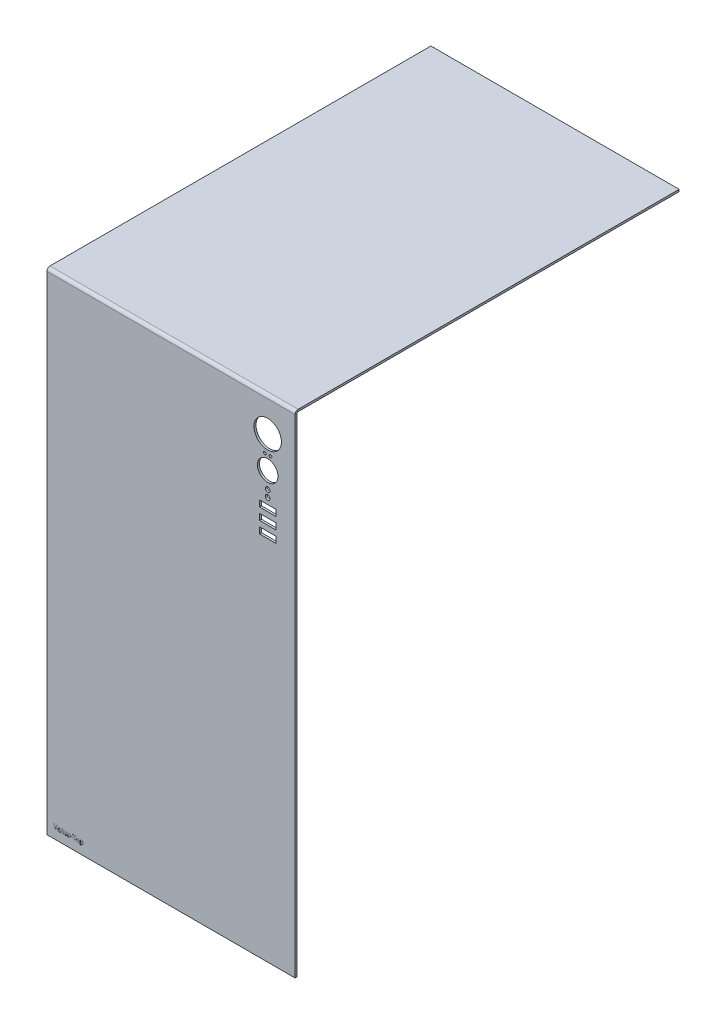
from build123d import *

# Parameters (mm, degrees)
SKETCH1_W                    = 181
SKETCH1_H                    = 358
BASE_FLANGE1_DEPTH           = 1.5
EDGE_FLANGE1_STRIP_W         = 7.4732
EDGE_FLANGE1_STRIP_H         = 1.5
EDGE_FLANGE1_STRIP_CUT_DEPTH = 181
EDGE_FLANGE1_DEPTH           = 181
CUT_EXTRUDE1_REACH           = 491.209
SKETCH9_R                    = 10
SKETCH9_R_2                  = 7.5
SKETCH9_R_3                  = 1
SKETCH9_R_4                  = 1.75
SKETCH9_W                    = 12
SKETCH9_H                    = 4.5
SKETCH10_W                   = 0.527397261
SKETCH10_H                   = 3.5
SKETCH10_W_2                 = 1.246575343
SKETCH10_H_2                 = 0.383561644
CUT_EXTRUDE2_DEPTH           = 0.05


# Sheet-metal steps are written as plain solids
with BuildPart() as part:
    # Sketch1 → Base-Flange1 (new body)
    with BuildSketch(Plane.XY):
        with Locations((90.5, -179)):
            Rectangle(SKETCH1_W, SKETCH1_H)
    extrude(amount=-BASE_FLANGE1_DEPTH)

    # Edge-Flange1 strip (across the edge) → Edge-Flange1 strip cut (cut)
    with BuildSketch(Plane(origin=(0, 0, -1.5), x_dir=(0, -1, 0), z_dir=(1, 0, 0))):
        with Locations((-1.5, -0.75)):
            Rectangle(EDGE_FLANGE1_STRIP_W, EDGE_FLANGE1_STRIP_H)
    extrude(amount=EDGE_FLANGE1_STRIP_CUT_DEPTH, mode=Mode.SUBTRACT)

    # Edge-Flange1 section (across the edge) → Edge-Flange1 (add)
    with BuildSketch(Plane(origin=(0, 0, -1.5), x_dir=(0, -1, 0), z_dir=(1, 0, 0))):
        with BuildLine():
            Line((0, 0.7366), (0, 278.5))
            Line((0, 278.5), (1.5, 278.5))
            Line((1.5, 278.5), (1.5, 0.7366))
            ThreePointArc((1.5, 0.7366), (1.715745145, 0.215745145), (2.2366, 0))
            Line((2.2366, 0), (2.2366, -1.5))
            ThreePointArc((2.2366, -1.5), (0.655084973, -0.844915027), (0, 0.7366))
        make_face()
    extrude(amount=EDGE_FLANGE1_DEPTH)

    # Sketch9 → Cut-Extrude1 (cut, up to next)
    with BuildSketch(Plane.XY, mode=Mode.PRIVATE) as cut_extrude1_sk1:
        with Locations((161, -24.566303236)):
            Circle(SKETCH9_R)
    cut_extrude1_tool1 = extrude(cut_extrude1_sk1.sketch, amount=-CUT_EXTRUDE1_REACH, mode=Mode.PRIVATE) & part.part
    # Sketch9 → Cut-Extrude1 (cut, up to next)
    with BuildSketch(Plane.XY, mode=Mode.PRIVATE) as cut_extrude1_sk2:
        with Locations((161, -47.566303236)):
            Circle(SKETCH9_R_2)
    cut_extrude1_tool2 = extrude(cut_extrude1_sk2.sketch, amount=-CUT_EXTRUDE1_REACH, mode=Mode.PRIVATE) & part.part
    # Sketch9 → Cut-Extrude1 (cut, up to next)
    with BuildSketch(Plane.XY, mode=Mode.PRIVATE) as cut_extrude1_sk3:
        with Locations((159, -37.566303236)):
            Circle(SKETCH9_R_3)
    cut_extrude1_tool3 = extrude(cut_extrude1_sk3.sketch, amount=-CUT_EXTRUDE1_REACH, mode=Mode.PRIVATE) & part.part
    # Sketch9 → Cut-Extrude1 (cut, up to next)
    with BuildSketch(Plane.XY, mode=Mode.PRIVATE) as cut_extrude1_sk4:
        with Locations((163, -37.566303236)):
            Circle(SKETCH9_R_3)
    cut_extrude1_tool4 = extrude(cut_extrude1_sk4.sketch, amount=-CUT_EXTRUDE1_REACH, mode=Mode.PRIVATE) & part.part
    # Sketch9 → Cut-Extrude1 (cut, up to next)
    with BuildSketch(Plane.XY, mode=Mode.PRIVATE) as cut_extrude1_sk5:
        with Locations((161, -59.566303236)):
            Circle(SKETCH9_R_4)
    cut_extrude1_tool5 = extrude(cut_extrude1_sk5.sketch, amount=-CUT_EXTRUDE1_REACH, mode=Mode.PRIVATE) & part.part
    # Sketch9 → Cut-Extrude1 (cut, up to next)
    with BuildSketch(Plane.XY, mode=Mode.PRIVATE) as cut_extrude1_sk6:
        with Locations((161, -64.566303236)):
            Circle(SKETCH9_R_4)
    cut_extrude1_tool6 = extrude(cut_extrude1_sk6.sketch, amount=-CUT_EXTRUDE1_REACH, mode=Mode.PRIVATE) & part.part
    # Sketch9 → Cut-Extrude1 (cut, up to next)
    with BuildSketch(Plane.XY, mode=Mode.PRIVATE) as cut_extrude1_sk7:
        with Locations((161, -71.316303236)):
            Rectangle(SKETCH9_W, SKETCH9_H)
    cut_extrude1_tool7 = extrude(cut_extrude1_sk7.sketch, amount=-CUT_EXTRUDE1_REACH, mode=Mode.PRIVATE) & part.part
    # Sketch9 → Cut-Extrude1 (cut, up to next)
    with BuildSketch(Plane.XY, mode=Mode.PRIVATE) as cut_extrude1_sk8:
        with Locations((161, -79.816303236)):
            Rectangle(SKETCH9_W, SKETCH9_H)
    cut_extrude1_tool8 = extrude(cut_extrude1_sk8.sketch, amount=-CUT_EXTRUDE1_REACH, mode=Mode.PRIVATE) & part.part
    # Sketch9 → Cut-Extrude1 (cut, up to next)
    with BuildSketch(Plane.XY, mode=Mode.PRIVATE) as cut_extrude1_sk9:
        with Locations((161, -88.316303236)):
            Rectangle(SKETCH9_W, SKETCH9_H)
    cut_extrude1_tool9 = extrude(cut_extrude1_sk9.sketch, amount=-CUT_EXTRUDE1_REACH, mode=Mode.PRIVATE) & part.part
    add(cut_extrude1_tool1.solids().sort_by_distance((161, -24.566303, 0))[0], mode=Mode.SUBTRACT)
    add(cut_extrude1_tool2.solids().sort_by_distance((161, -47.566303, 0))[0], mode=Mode.SUBTRACT)
    add(cut_extrude1_tool3.solids().sort_by_distance((159, -37.566303, 0))[0], mode=Mode.SUBTRACT)
    add(cut_extrude1_tool4.solids().sort_by_distance((163, -37.566303, 0))[0], mode=Mode.SUBTRACT)
    add(cut_extrude1_tool5.solids().sort_by_distance((161, -59.566303, 0))[0], mode=Mode.SUBTRACT)
    add(cut_extrude1_tool6.solids().sort_by_distance((161, -64.566303, 0))[0], mode=Mode.SUBTRACT)
    add(cut_extrude1_tool7.solids().sort_by_distance((161, -71.316303, 0))[0], mode=Mode.SUBTRACT)
    add(cut_extrude1_tool8.solids().sort_by_distance((161, -79.816303, 0))[0], mode=Mode.SUBTRACT)
    add(cut_extrude1_tool9.solids().sort_by_distance((161, -88.316303, 0))[0], mode=Mode.SUBTRACT)

    # Sketch10 → Cut-Extrude2 (cut)
    # profile 1 of 9: a face of its own
    with BuildSketch(Plane.XY):
        Polygon((7.759056417, -348.134137559), (6.600130903, -351.634137559), (6.059998198, -351.634137559), (4.882344088, -348.134137559), (5.455439123, -348.134137559), (6.366398027, -350.962904683), (7.259377479, -348.134137559), align=None)
    # profile 2 of 9: a face of its own
    with BuildSketch(Plane.XY):
        with BuildLine():
            Line((10.204261897, -351.634137559), (9.685105218, -351.634137559))
            add(Edge.make_bspline(
                [(9.685105218, -351.634137559), (9.680035856, -351.605217846), (9.668894197, -351.54165687), (9.658416308, -351.43704997), (9.6513483, -351.315325913), (9.648445583, -351.228610032), (9.646898883, -351.182403826)],
                knots=[0, 0, 0, 0, 0.776151292, 1.705858299, 2.777575903, 4, 4, 4, 4], degree=3))
            add(Edge.make_bspline(
                [(9.646898883, -351.182403826), (9.640333765, -351.202796198), (9.627460621, -351.24278237), (9.60108452, -351.299214363), (9.572547503, -351.352693016), (9.538220376, -351.401380383), (9.501053969, -351.446919972), (9.458285163, -351.487160807), (9.412892053, -351.525180687), (9.362089338, -351.558056417), (9.307382254, -351.587211527), (9.248718405, -351.61260362), (9.186279336, -351.634731649), (9.11914033, -351.651349465), (9.048268778, -351.665940682), (8.972899975, -351.67556207), (8.893575706, -351.680448495), (8.839327861, -351.681530028), (8.811603506, -351.682082765)],
                knots=[0, 0, 0, 0, 0.975469499, 1.912739392, 2.834749978, 3.734574456, 4.623535464, 5.508992012, 6.40672647, 7.319061521, 8.261087935, 9.229559954, 10.230268345, 11.276544069, 12.379245833, 13.527021249, 14.736138942, 16, 16, 16, 16], degree=3))
            add(Edge.make_bspline(
                [(8.811603506, -351.682082765), (8.776372094, -351.68131196), (8.7077456, -351.679810527), (8.607647815, -351.669651848), (8.513960419, -351.650825011), (8.426299127, -351.625106915), (8.344469471, -351.593626465), (8.269436001, -351.553007102), (8.200079866, -351.50617028), (8.138478398, -351.451059175), (8.082746487, -351.392117939), (8.035010879, -351.329045011), (7.993912137, -351.263552081), (7.961079133, -351.194780063), (7.934192389, -351.123556784), (7.916820302, -351.048696976), (7.904889202, -350.971277994), (7.903564094, -350.918502411), (7.902892034, -350.891736018)],
                knots=[0, 0, 0, 0, 1.249730742, 2.434323096, 3.563471788, 4.634200097, 5.672110158, 6.666786976, 7.654458243, 8.633552524, 9.592362774, 10.527770243, 11.434773132, 12.330109344, 13.226890318, 14.129209857, 15.05118427, 16, 16, 16, 16], degree=3))
            add(Edge.make_bspline(
                [(7.902892034, -350.891736018), (7.903864329, -350.859458481), (7.905775731, -350.796005221), (7.921924233, -350.703144913), (7.948391161, -350.615022999), (7.984289034, -350.530817623), (8.03203171, -350.452168362), (8.089725679, -350.377640051), (8.158362981, -350.308390763), (8.236734856, -350.242174475), (8.327955967, -350.182658228), (8.433402489, -350.131952877), (8.552312199, -350.08850751), (8.685408867, -350.054069661), (8.831785678, -350.026299332), (8.99200314, -350.007552345), (9.166003664, -349.995214191), (9.286787004, -349.994094052), (9.34948878, -349.993512559)],
                knots=[0, 0, 0, 0, 0.808525439, 1.589451338, 2.353749103, 3.110605451, 3.876950355, 4.653096827, 5.467414761, 6.316003643, 7.220384927, 8.188825422, 9.242177308, 10.388307889, 11.630476528, 12.97341699, 14.428821987, 16, 16, 16, 16], degree=3))
            add(Edge.make_bspline(
                [(9.34948878, -349.993512559), (9.368219552, -349.993670026), (9.408938575, -349.994012346), (9.474350601, -349.996665233), (9.548790887, -349.999363797), (9.601205934, -350.002396884), (9.628919431, -350.004000573)],
                knots=[0, 0, 0, 0, 0.803713308, 1.747200887, 2.808873687, 4, 4, 4, 4], degree=3))
            add(Edge.make_bspline(
                [(9.628919431, -350.004000573), (9.62869943, -349.969767606), (9.628285966, -349.905431058), (9.619894422, -349.81608042), (9.607881578, -349.739905866), (9.589633823, -349.675466887), (9.561181021, -349.62030414), (9.522608996, -349.570833742), (9.468876981, -349.530475287), (9.405925615, -349.492919908), (9.329775334, -349.464439793), (9.24222235, -349.442327208), (9.142241262, -349.431464373), (9.071824489, -349.429624324), (9.034848369, -349.428658107)],
                knots=[0, 0, 0, 0, 1.264261331, 2.376019809, 3.311853705, 4.111591798, 4.837811274, 5.592820636, 6.406904951, 7.304104159, 8.29438249, 9.397532684, 10.633434353, 12, 12, 12, 12], degree=3))
            add(Edge.make_bspline(
                [(9.034848369, -349.428658107), (8.993804545, -349.429824009), (8.915412225, -349.432050844), (8.804302644, -349.452238486), (8.705882179, -349.48576181), (8.620343677, -349.533470452), (8.547605937, -349.595014511), (8.48922629, -349.671107949), (8.443334984, -349.76020775), (8.424878875, -349.826027065), (8.415306417, -349.860164956)],
                knots=[0, 0, 0, 0, 1.192066422, 2.276806714, 3.268390141, 4.201035685, 5.107124908, 6.017390214, 6.971698217, 8, 8, 8, 8], degree=3))
            Line((8.415306417, -349.860164956), (7.950837239, -349.788996292))
            add(Edge.make_bspline(
                [(7.950837239, -349.788996292), (7.957268594, -349.756896216), (7.969863694, -349.694031752), (7.997827899, -349.604038636), (8.032129356, -349.519967691), (8.07457493, -349.442855776), (8.122399396, -349.370697302), (8.178384116, -349.30578475), (8.239857331, -349.245655753), (8.309548789, -349.193430207), (8.385326535, -349.146573309), (8.468770905, -349.107077857), (8.558287824, -349.072521965), (8.655138553, -349.044981145), (8.758247155, -349.023199144), (8.868483822, -349.008875063), (8.985207081, -348.998477316), (9.065538084, -348.997601005), (9.106766177, -348.997151258)],
                knots=[0, 0, 0, 0, 1.015436062, 1.988619719, 2.919794507, 3.828378544, 4.71609894, 5.601244657, 6.48367207, 7.379575014, 8.298020962, 9.244295137, 10.240262638, 11.272854284, 12.36569163, 13.507735132, 14.720900723, 16, 16, 16, 16], degree=3))
            add(Edge.make_bspline(
                [(9.106766177, -348.997151258), (9.152741907, -348.997754624), (9.241615874, -348.998920968), (9.36953505, -349.011053485), (9.487241339, -349.030377568), (9.594608735, -349.056643268), (9.691296299, -349.091965287), (9.777483641, -349.134921339), (9.854198986, -349.18467452), (9.919394385, -349.244709679), (9.976955684, -349.312110492), (10.024277085, -349.390386791), (10.06605905, -349.477221627), (10.099564481, -349.574258364), (10.124411766, -349.681324918), (10.143122904, -349.797693886), (10.154344779, -349.923872559), (10.155644031, -350.011218926), (10.156316691, -350.056440641)],
                knots=[0, 0, 0, 0, 1.271049596, 2.457018525, 3.549108944, 4.567381627, 5.508965739, 6.389090511, 7.226032361, 8.027764574, 8.831457087, 9.66882613, 10.549086337, 11.492517066, 12.500789717, 13.584948391, 14.74965862, 16, 16, 16, 16], degree=3))
            Line((10.156316691, -350.056440641), (10.156316691, -351.106740299))
            add(Edge.make_bspline(
                [(10.156316691, -351.106740299), (10.156882847, -351.150956219), (10.158013123, -351.23922908), (10.16747644, -351.371444742), (10.182004817, -351.503245758), (10.19684157, -351.590499315), (10.204261897, -351.634137559)],
                knots=[0, 0, 0, 0, 1.000520471, 1.997443518, 2.998458622, 4, 4, 4, 4], degree=3))
        make_face()
        with BuildLine():
            add(Edge.make_bspline(
                [(9.628919431, -350.432510847), (9.599457503, -350.430681947), (9.543297882, -350.427195741), (9.46338059, -350.423492775), (9.391706091, -350.421022833), (9.346743638, -350.420684349), (9.325516177, -350.420524546)],
                knots=[0, 0, 0, 0, 1.166393908, 2.223352165, 3.16121744, 4, 4, 4, 4], degree=3))
            add(Edge.make_bspline(
                [(9.325516177, -350.420524546), (9.292290233, -350.420643982), (9.227527261, -350.420876785), (9.133615755, -350.427510993), (9.045456351, -350.43566159), (8.963851749, -350.44973459), (8.887725714, -350.465410803), (8.818164636, -350.486906474), (8.753803581, -350.510254098), (8.696409684, -350.538968857), (8.644522325, -350.570131356), (8.600182866, -350.606447752), (8.562090787, -350.646092906), (8.531954116, -350.690465055), (8.507652147, -350.737900178), (8.490072827, -350.789553231), (8.480674252, -350.845447765), (8.479061771, -350.883962568), (8.478234499, -350.903722319)],
                knots=[0, 0, 0, 0, 1.45711978, 2.840172304, 4.1285782, 5.33879564, 6.471148492, 7.535094115, 8.530030164, 9.470655413, 10.346197382, 11.179391502, 11.977571569, 12.749381569, 13.523442768, 14.309808512, 15.132859021, 16, 16, 16, 16], degree=3))
            add(Edge.make_bspline(
                [(8.478234499, -350.903722319), (8.479445078, -350.928830972), (8.48178857, -350.977437434), (8.502373634, -351.046637177), (8.537856621, -351.106999347), (8.585949724, -351.158875521), (8.647081842, -351.200934045), (8.721275789, -351.229334717), (8.806464583, -351.247769608), (8.867181138, -351.249605922), (8.899253335, -351.250575915)],
                knots=[0, 0, 0, 0, 0.976096897, 1.889572353, 2.778295161, 3.679479282, 4.623283261, 5.639651782, 6.753197474, 8, 8, 8, 8], degree=3))
            add(Edge.make_bspline(
                [(8.899253335, -351.250575915), (8.925269089, -351.250176624), (8.976277759, -351.24939374), (9.050887322, -351.238017728), (9.122089778, -351.222210387), (9.18957268, -351.19853163), (9.253553287, -351.168377768), (9.314392436, -351.131898795), (9.37097154, -351.087636459), (9.423676676, -351.037998194), (9.471169091, -350.983492858), (9.51355873, -350.926300705), (9.549553113, -350.866761621), (9.578335181, -350.804334221), (9.600601599, -350.740025801), (9.617481056, -350.673446907), (9.627381805, -350.604366112), (9.62840296, -350.557399606), (9.628919431, -350.533645265)],
                knots=[0, 0, 0, 0, 1.094244261, 2.145467124, 3.170711452, 4.161578386, 5.149260772, 6.144580063, 7.141397536, 8.167773332, 9.188479246, 10.181018155, 11.16190609, 12.112112195, 13.069734655, 14.023424357, 15.000303466, 16, 16, 16, 16], degree=3))
            add(Edge.make_bspline(
                [(9.628919431, -350.533645265), (9.628919431, -350.514916669), (9.628919431, -350.481205196), (9.628919431, -350.447493724), (9.628919431, -350.432510847)],
                knots=[0, 0, 0, 0, 1.111111111, 2, 2, 2, 2], degree=3))
        make_face(mode=Mode.SUBTRACT)
    # profile 3 of 9: a face of its own
    with BuildSketch(Plane.XY):
        with Locations((11.139193404, -349.884137559)):
            Rectangle(SKETCH10_W, SKETCH10_H)
    # profile 4 of 9: a face of its own
    with BuildSketch(Plane.XY):
        with BuildLine():
            Line((14.231659157, -351.634137559), (13.752207102, -351.634137559))
            Line((13.752207102, -351.634137559), (13.752207102, -351.154685504))
            add(Edge.make_bspline(
                [(13.752207102, -351.154685504), (13.738827363, -351.196438865), (13.713010237, -351.277004849), (13.653376472, -351.385417215), (13.580865067, -351.478423487), (13.492213817, -351.553636353), (13.389237327, -351.612041972), (13.272031803, -351.652980512), (13.14095714, -351.677925197), (13.048878792, -351.680656882), (13.000815835, -351.682082765)],
                knots=[0, 0, 0, 0, 1.052079265, 2.030059363, 2.957411664, 3.873028321, 4.806135154, 5.787941106, 6.845351887, 8, 8, 8, 8], degree=3))
            add(Edge.make_bspline(
                [(13.000815835, -351.682082765), (12.967573937, -351.681122542), (12.902866759, -351.679253416), (12.8083768, -351.667531048), (12.719963143, -351.64622607), (12.636430216, -351.618121911), (12.559202305, -351.580025431), (12.486303924, -351.535113857), (12.419810049, -351.480791132), (12.358543635, -351.41895508), (12.303974017, -351.349335801), (12.256817068, -351.272546091), (12.216581789, -351.189324846), (12.184767627, -351.098962158), (12.159405692, -351.001972914), (12.140503901, -350.898606147), (12.130302916, -350.788311076), (12.128825128, -350.712710435), (12.128063266, -350.673735162)],
                knots=[0, 0, 0, 0, 1.055403191, 2.054400236, 3.01579575, 3.938364529, 4.845997079, 5.743429036, 6.650923101, 7.564628224, 8.501861714, 9.452245446, 10.420187899, 11.43069321, 12.488237783, 13.600011547, 14.7627062, 16, 16, 16, 16], degree=3))
            Line((12.128063266, -350.673735162), (12.128063266, -349.045096463))
            Line((12.128063266, -349.045096463), (12.655460527, -349.045096463))
            Line((12.655460527, -349.045096463), (12.655460527, -350.659501429))
            add(Edge.make_bspline(
                [(12.655460527, -350.659501429), (12.655920634, -350.688228339), (12.656797926, -350.743002253), (12.662591769, -350.821602671), (12.672903123, -350.892454532), (12.687032868, -350.955867614), (12.704644763, -351.011862025), (12.727068951, -351.060371249), (12.754011744, -351.101450195), (12.794802911, -351.14435422), (12.849452132, -351.185951483), (12.91730412, -351.222424898), (12.986063835, -351.245966798), (13.032607685, -351.249056193), (13.055503335, -351.250575915)],
                knots=[0, 0, 0, 0, 1.284959724, 2.450046835, 3.522634902, 4.484597285, 5.353544529, 6.143050038, 6.867966782, 7.539733069, 8.781939257, 9.921255061, 10.977432771, 12, 12, 12, 12], degree=3))
            add(Edge.make_bspline(
                [(13.055503335, -351.250575915), (13.083823089, -351.249469917), (13.139800544, -351.247283777), (13.221298838, -351.228482277), (13.298879858, -351.199080346), (13.372212165, -351.157444182), (13.439972775, -351.103608794), (13.503946114, -351.04061673), (13.559517983, -350.965217559), (13.610462707, -350.882244416), (13.652390992, -350.791413263), (13.682244952, -350.694951183), (13.700934431, -350.594548199), (13.703144432, -350.526235055), (13.704261897, -350.49169321)],
                knots=[0, 0, 0, 0, 0.921127991, 1.820722076, 2.708665052, 3.615360246, 4.553873904, 5.519813939, 6.529723644, 7.595131107, 8.686655073, 9.777088182, 10.876007279, 12, 12, 12, 12], degree=3))
            Line((13.704261897, -350.49169321), (13.704261897, -349.045096463))
            Line((13.704261897, -349.045096463), (14.231659157, -349.045096463))
            Line((14.231659157, -349.045096463), (14.231659157, -351.634137559))
        make_face()
    # profile 5 of 9: a face of its own
    with BuildSketch(Plane.XY):
        with BuildLine():
            Line((16.64839717, -350.771123861), (17.108371486, -350.865515984))
            add(Edge.make_bspline(
                [(17.108371486, -350.865515984), (17.099086831, -350.894894055), (17.080658068, -350.953205485), (17.045120517, -351.037435259), (17.003304404, -351.117798774), (16.95432146, -351.19352526), (16.899298115, -351.265269723), (16.837547587, -351.332818025), (16.769336116, -351.396661003), (16.694761868, -351.455319835), (16.615323311, -351.508774645), (16.531577531, -351.555082717), (16.443849404, -351.594352422), (16.352676131, -351.626548778), (16.257628097, -351.651165654), (16.159037761, -351.669377227), (16.056547144, -351.679760198), (15.986925594, -351.681302353), (15.951693403, -351.682082765)],
                knots=[0, 0, 0, 0, 0.970376838, 1.926064515, 2.876295158, 3.821332085, 4.764007728, 5.721992307, 6.701765842, 7.704491662, 8.708328194, 9.715581711, 10.715803919, 11.733604561, 12.758436724, 13.806327211, 14.889885399, 16, 16, 16, 16], degree=3))
            add(Edge.make_bspline(
                [(15.951693403, -351.682082765), (15.90818032, -351.680943238), (15.823049845, -351.678713829), (15.698628478, -351.660901986), (15.580390307, -351.632981841), (15.468773821, -351.591949811), (15.363377697, -351.540249734), (15.264324152, -351.476699739), (15.172011557, -351.401409908), (15.086730978, -351.31520247), (15.009931416, -351.219786516), (14.94306025, -351.116419704), (14.885557775, -351.006532209), (14.839276385, -350.889182807), (14.803181869, -350.765026246), (14.778139558, -350.633832242), (14.761854782, -350.495847906), (14.760002154, -350.401344201), (14.759056417, -350.3531016)],
                knots=[0, 0, 0, 0, 1.04006308, 2.034814766, 2.999340677, 3.940044222, 4.872008889, 5.801215012, 6.747756153, 7.714644925, 8.69566404, 9.67116158, 10.653978049, 11.656334954, 12.682403234, 13.741017884, 14.846826472, 16, 16, 16, 16], degree=3))
            add(Edge.make_bspline(
                [(14.759056417, -350.3531016), (14.759918335, -350.303852797), (14.761603541, -350.207562408), (14.779026759, -350.066877683), (14.804594074, -349.932859765), (14.841782757, -349.805946002), (14.891263854, -349.686968215), (14.949580541, -349.5743538), (15.019571798, -349.469249876), (15.099729932, -349.372200854), (15.187450433, -349.283999328), (15.282178477, -349.207175266), (15.382569308, -349.142523174), (15.487808405, -349.088304391), (15.599729525, -349.048578805), (15.716076201, -349.017839326), (15.838563697, -349.000697114), (15.921927421, -348.998348602), (15.964428849, -348.997151258)],
                knots=[0, 0, 0, 0, 1.161981899, 2.271886461, 3.341228114, 4.380111636, 5.387202716, 6.378576049, 7.369318291, 8.361812572, 9.345497792, 10.301088288, 11.23469979, 12.160012026, 13.088679061, 14.032285896, 14.996797951, 16, 16, 16, 16], degree=3))
            add(Edge.make_bspline(
                [(15.964428849, -348.997151258), (16.008941514, -348.99796407), (16.095825268, -348.999550588), (16.22219393, -349.017554901), (16.341674673, -349.045141542), (16.454448591, -349.083521795), (16.559195501, -349.13546904), (16.657406307, -349.196794212), (16.747801336, -349.270387561), (16.831307231, -349.354454194), (16.906558389, -349.449991301), (16.972122559, -349.557370786), (17.027169948, -349.676200248), (17.073099395, -349.806104822), (17.108664554, -349.947351677), (17.134599092, -350.100138786), (17.151148129, -350.264101297), (17.154066356, -350.377284064), (17.155567547, -350.435507422)],
                knots=[0, 0, 0, 0, 1.007988209, 1.967480452, 2.885707445, 3.784034793, 4.659637926, 5.52935221, 6.402465227, 7.294730762, 8.209394118, 9.151713907, 10.138952695, 11.171606156, 12.269526521, 13.435146202, 14.680590665, 16, 16, 16, 16], degree=3))
            Line((17.155567547, -350.435507422), (15.334398883, -350.435507422))
            add(Edge.make_bspline(
                [(15.334398883, -350.435507422), (15.335206347, -350.473978131), (15.33675064, -350.547554168), (15.345953, -350.653369017), (15.363478713, -350.749177655), (15.385613936, -350.83604779), (15.417119253, -350.912305984), (15.453006829, -350.980060363), (15.498091924, -351.036916819), (15.564536453, -351.098697847), (15.654662587, -351.158015629), (15.765709757, -351.210586026), (15.878070944, -351.244371834), (15.953971433, -351.248527), (15.991398027, -351.250575915)],
                knots=[0, 0, 0, 0, 1.168215704, 2.234237016, 3.220252785, 4.123285562, 4.949738847, 5.720030982, 6.443529022, 7.140809292, 8.467714642, 9.698914626, 10.865332904, 12, 12, 12, 12], degree=3))
            add(Edge.make_bspline(
                [(15.991398027, -351.250575915), (16.027977547, -351.249215819), (16.099368743, -351.246561358), (16.202374126, -351.223537933), (16.29757636, -351.185732607), (16.384820815, -351.132399399), (16.464250386, -351.064128756), (16.534975181, -350.980457866), (16.597675252, -350.882016524), (16.631053788, -350.80904147), (16.64839717, -350.771123861)],
                knots=[0, 0, 0, 0, 1.010202366, 1.971582825, 2.900930486, 3.830278146, 4.784918799, 5.783736102, 6.848436203, 8, 8, 8, 8], degree=3))
        make_face()
        with BuildLine():
            add(Edge.make_bspline(
                [(16.580974225, -350.051945778), (16.579414395, -350.028924581), (16.576257679, -349.982335288), (16.563253271, -349.912253423), (16.542510997, -349.841782376), (16.516315719, -349.770636222), (16.48056142, -349.701706588), (16.434327522, -349.63697386), (16.376781903, -349.578727293), (16.310433946, -349.526341016), (16.235445976, -349.482388781), (16.151973465, -349.450820463), (16.060939702, -349.431641317), (15.997737644, -349.429672419), (15.965177992, -349.428658107)],
                knots=[0, 0, 0, 0, 0.850487428, 1.721179275, 2.621893019, 3.557525288, 4.51320381, 5.47674886, 6.479715867, 7.522526024, 8.587189943, 9.671587617, 10.800477401, 12, 12, 12, 12], degree=3))
            add(Edge.make_bspline(
                [(15.965177992, -349.428658107), (15.945422612, -349.429281513), (15.906241381, -349.430517927), (15.848529427, -349.438935934), (15.792611152, -349.452524254), (15.738293868, -349.471274998), (15.685655891, -349.495924369), (15.635662395, -349.527325427), (15.586306019, -349.562197242), (15.540689931, -349.603666624), (15.496840613, -349.647875131), (15.45923799, -349.697064084), (15.424433491, -349.747841147), (15.397515789, -349.803404434), (15.372691899, -349.860695798), (15.355378372, -349.92203375), (15.341286877, -349.98576355), (15.33671896, -350.029653671), (15.334398883, -350.051945778)],
                knots=[0, 0, 0, 0, 0.971932655, 1.927652895, 2.863418533, 3.799909913, 4.750799854, 5.715951772, 6.701535727, 7.719892262, 8.745266678, 9.760430749, 10.762346635, 11.767947569, 12.792511849, 13.830544334, 14.898117893, 16, 16, 16, 16], degree=3))
            Line((15.334398883, -350.051945778), (16.580974225, -350.051945778))
        make_face(mode=Mode.SUBTRACT)
    # profile 6 of 9: a face of its own
    with BuildSketch(Plane.XY):
        with Locations((18.019330389, -350.339617011)):
            Rectangle(SKETCH10_W_2, SKETCH10_H_2)
    # profile 7 of 9: a face of its own
    with BuildSketch(Plane.XY):
        Polygon((20.224809842, -351.634137559), (19.649467376, -351.634137559), (19.649467376, -348.613589614), (18.690563266, -348.613589614), (18.690563266, -348.134137559), (21.183713951, -348.134137559), (21.183713951, -348.613589614), (20.224809842, -348.613589614), align=None)
    # profile 8 of 9: a face of its own
    with BuildSketch(Plane.XY):
        with BuildLine():
            add(Edge.make_bspline(
                [(22.51943741, -351.682082765), (22.475404256, -351.681108291), (22.389661933, -351.679210775), (22.265062912, -351.659319139), (22.147546429, -351.6303903), (22.03791393, -351.586775808), (21.935131467, -351.532163349), (21.840596437, -351.464200665), (21.75336473, -351.384497104), (21.674612229, -351.293429352), (21.604991964, -351.1931015), (21.542912681, -351.087204621), (21.491093211, -350.975028994), (21.449363552, -350.857015851), (21.416247913, -350.73353396), (21.392400387, -350.604565754), (21.377782489, -350.469807679), (21.376267102, -350.378110564), (21.375494773, -350.331376429)],
                knots=[0, 0, 0, 0, 1.061341894, 2.066668209, 3.036833985, 3.975400648, 4.905246388, 5.8380341, 6.776136663, 7.749737721, 8.735783364, 9.718381832, 10.707550845, 11.711703294, 12.734600131, 13.78853052, 14.872907676, 16, 16, 16, 16], degree=3))
            add(Edge.make_bspline(
                [(21.375494773, -350.331376429), (21.37648362, -350.282145342), (21.378416422, -350.185918118), (21.394008184, -350.045452407), (21.421498523, -349.912831302), (21.457546222, -349.787041957), (21.505941447, -349.668992029), (21.564243689, -349.558283616), (21.634053183, -349.45568965), (21.712879668, -349.360850809), (21.80032599, -349.276178753), (21.89289446, -349.200983561), (21.991159433, -349.137939797), (22.095058438, -349.086596918), (22.203627787, -349.045925007), (22.317696016, -349.017363778), (22.436795576, -349.000846082), (22.517887927, -348.998397119), (22.559142034, -348.997151258)],
                knots=[0, 0, 0, 0, 1.181478652, 2.309321578, 3.386031207, 4.42915366, 5.445324698, 6.442727674, 7.426842105, 8.418320792, 9.397403229, 10.343742355, 11.276450625, 12.19315355, 13.120531573, 14.053778892, 15.009899073, 16, 16, 16, 16], degree=3))
            add(Edge.make_bspline(
                [(22.559142034, -348.997151258), (22.605910825, -348.998159973), (22.69734593, -349.000132057), (22.829992786, -349.019621261), (22.955027583, -349.049095779), (23.071828297, -349.091903978), (23.180414897, -349.147697963), (23.280784518, -349.215872036), (23.373558425, -349.295338783), (23.456192051, -349.387473123), (23.530388495, -349.486952556), (23.595542035, -349.592671144), (23.649956703, -349.703723), (23.695468677, -349.819563154), (23.729732249, -349.940847239), (23.754352522, -350.067127145), (23.769707999, -350.198651144), (23.771728096, -350.288133815), (23.772755047, -350.333623861)],
                knots=[0, 0, 0, 0, 1.105317622, 2.160945972, 3.163558409, 4.138823878, 5.094913291, 6.043256811, 7.002132521, 7.976163556, 8.963547238, 9.933829605, 10.908361759, 11.884377858, 12.873190933, 13.884254739, 14.924424741, 16, 16, 16, 16], degree=3))
            add(Edge.make_bspline(
                [(23.772755047, -350.333623861), (23.771894206, -350.38087843), (23.770207981, -350.473441182), (23.752641083, -350.609109874), (23.727210069, -350.739182675), (23.689520681, -350.863389858), (23.640790671, -350.981296007), (23.580983206, -351.092996221), (23.511116923, -351.198879084), (23.431648751, -351.298246515), (23.342477436, -351.387796419), (23.24654712, -351.467424612), (23.14231321, -351.533498365), (23.031185299, -351.587737812), (22.913305373, -351.630820217), (22.788059533, -351.660342406), (22.656088456, -351.678885235), (22.565698502, -351.681000291), (22.51943741, -351.682082765)],
                knots=[0, 0, 0, 0, 1.097126729, 2.149063523, 3.172955721, 4.173089872, 5.158803593, 6.131994298, 7.111818611, 8.102028355, 9.08238485, 10.04276665, 10.992206533, 11.941735018, 12.910645961, 13.901161508, 14.925825754, 16, 16, 16, 16], degree=3))
        make_face()
        with BuildLine():
            add(Edge.make_bspline(
                [(22.54865402, -351.250575915), (22.571160602, -351.249753455), (22.615384309, -351.248137383), (22.680557623, -351.238399822), (22.743045, -351.221269097), (22.80227255, -351.196054498), (22.859013592, -351.165342975), (22.912756659, -351.127322379), (22.963591098, -351.082225212), (23.011731675, -351.03023799), (23.056536051, -350.971279535), (23.093710236, -350.902724937), (23.12568622, -350.826857603), (23.153149505, -350.74310094), (23.172695066, -350.65086649), (23.186566958, -350.550959302), (23.195933303, -350.443174195), (23.196906934, -350.368605014), (23.197412581, -350.329878141)],
                knots=[0, 0, 0, 0, 0.851960802, 1.674037608, 2.488088101, 3.297295633, 4.105177318, 4.925949067, 5.783084561, 6.672595414, 7.604530661, 8.577638254, 9.61517014, 10.718101912, 11.90833532, 13.178168094, 14.534505499, 16, 16, 16, 16], degree=3))
            add(Edge.make_bspline(
                [(23.197412581, -350.329878141), (23.196856949, -350.291158199), (23.195787069, -350.216602363), (23.187101212, -350.108896842), (23.171056031, -350.009901848), (23.15080027, -349.918639239), (23.123046307, -349.836106761), (23.089485166, -349.761649653), (23.048731558, -349.696277324), (23.00284656, -349.638739238), (22.952299931, -349.589929778), (22.900546647, -349.546157906), (22.845583693, -349.510959244), (22.78995638, -349.479670182), (22.731085192, -349.457802908), (22.670717621, -349.441152191), (22.608250303, -349.429933003), (22.56568292, -349.429086256), (22.544159157, -349.428658107)],
                knots=[0, 0, 0, 0, 1.483754111, 2.856991061, 4.136040058, 5.324537516, 6.435126464, 7.467072189, 8.446945409, 9.379509932, 10.27949352, 11.135943353, 11.971995376, 12.776965168, 13.576684854, 14.370658526, 15.176140078, 16, 16, 16, 16], degree=3))
            add(Edge.make_bspline(
                [(22.544159157, -349.428658107), (22.525138406, -349.429170748), (22.487339828, -349.430189482), (22.431478296, -349.440343155), (22.377463222, -349.456815296), (22.325195624, -349.479895337), (22.273732605, -349.508200543), (22.224580618, -349.544412519), (22.177307951, -349.587125367), (22.13015848, -349.634616481), (22.08741915, -349.690973666), (22.050471387, -349.75621601), (22.020030083, -349.830373305), (21.994866437, -349.91295058), (21.974554397, -350.004072044), (21.960666885, -350.104023284), (21.952594044, -350.212877579), (21.951437667, -350.288411209), (21.950837239, -350.32763071)],
                knots=[0, 0, 0, 0, 0.756320576, 1.502981824, 2.251162625, 2.998881281, 3.77301222, 4.584026971, 5.421698356, 6.307225525, 7.243388263, 8.22703282, 9.282737436, 10.426926748, 11.658977428, 12.994127987, 14.439254114, 16, 16, 16, 16], degree=3))
            add(Edge.make_bspline(
                [(21.950837239, -350.32763071), (21.951452064, -350.369094761), (21.952638557, -350.449112275), (21.960530499, -350.564225869), (21.974730146, -350.669293785), (21.993820528, -350.76462161), (22.019273246, -350.850071625), (22.049391405, -350.926369319), (22.086327579, -350.992309165), (22.128720301, -351.048283787), (22.175097763, -351.095638049), (22.223110691, -351.136774863), (22.272320774, -351.172901986), (22.324704594, -351.19986084), (22.377512272, -351.223602361), (22.433155092, -351.238622298), (22.490323786, -351.249116576), (22.529127382, -351.250087387), (22.54865402, -351.250575915)],
                knots=[0, 0, 0, 0, 1.609501114, 3.10602256, 4.475479225, 5.722524972, 6.875622541, 7.93220141, 8.900043992, 9.79956054, 10.649563263, 11.467514925, 12.252885294, 13.011790242, 13.749985317, 14.495588805, 15.242954357, 16, 16, 16, 16], degree=3))
        make_face(mode=Mode.SUBTRACT)
    # profile 9 of 9: a face of its own
    with BuildSketch(Plane.XY):
        with BuildLine():
            Line((24.827549568, -352.497151258), (24.300152307, -352.497151258))
            Line((24.300152307, -352.497151258), (24.300152307, -349.045096463))
            Line((24.300152307, -349.045096463), (24.779604362, -349.045096463))
            Line((24.779604362, -349.045096463), (24.779604362, -349.572493724))
            add(Edge.make_bspline(
                [(24.779604362, -349.572493724), (24.78573933, -349.549160876), (24.797741922, -349.503511952), (24.821374709, -349.438385125), (24.84728037, -349.377273548), (24.877434173, -349.321073225), (24.910400385, -349.269167425), (24.946430006, -349.2215221), (24.986316833, -349.178579613), (25.029903018, -349.140403107), (25.076521442, -349.106501407), (25.126204697, -349.077192993), (25.179067651, -349.052229456), (25.235536525, -349.032026613), (25.295479373, -349.016417335), (25.35860632, -349.005271115), (25.424962065, -348.998349512), (25.47029755, -348.997557352), (25.493538438, -348.997151258)],
                knots=[0, 0, 0, 0, 1.154591624, 2.258869823, 3.313891012, 4.330193312, 5.308655691, 6.255637477, 7.18624941, 8.109690524, 9.025670621, 9.94227479, 10.867571758, 11.820647877, 12.809573837, 13.829807145, 14.88746733, 16, 16, 16, 16], degree=3))
            add(Edge.make_bspline(
                [(25.493538438, -348.997151258), (25.535301221, -348.998270032), (25.616983559, -349.000458201), (25.736246482, -349.018534378), (25.848339598, -349.049685861), (25.954297025, -349.091166469), (26.05242398, -349.14701468), (26.144380336, -349.213621619), (26.22869726, -349.293532122), (26.306219566, -349.383709752), (26.374804254, -349.483022334), (26.436456031, -349.587487135), (26.487047589, -349.698196758), (26.529397975, -349.813797549), (26.561390132, -349.93501309), (26.584514993, -350.061478382), (26.599217349, -350.193186698), (26.600746691, -350.282892795), (26.60152217, -350.328379854)],
                knots=[0, 0, 0, 0, 1.032400941, 2.019236126, 2.973502293, 3.904591322, 4.825240442, 5.757741251, 6.705733437, 7.690963807, 8.693097297, 9.686517747, 10.686651672, 11.698516496, 12.727532476, 13.782439121, 14.875546656, 16, 16, 16, 16], degree=3))
            add(Edge.make_bspline(
                [(26.60152217, -350.328379854), (26.600753762, -350.377607951), (26.599252536, -350.473784072), (26.584763203, -350.614554972), (26.560750292, -350.747956657), (26.528476927, -350.874681537), (26.484102064, -350.993208203), (26.432931036, -351.105978958), (26.37029938, -351.210778252), (26.299527663, -351.308018932), (26.220953656, -351.395893096), (26.135320321, -351.472934408), (26.042669943, -351.537736615), (25.943673984, -351.590396267), (25.838778667, -351.632168135), (25.727303152, -351.661110217), (25.609464852, -351.678669174), (25.528810254, -351.680927399), (25.487545287, -351.682082765)],
                knots=[0, 0, 0, 0, 1.19900762, 2.342481368, 3.442706028, 4.499207359, 5.523118662, 6.522038026, 7.512156496, 8.491677521, 9.448047426, 10.378645842, 11.291679483, 12.195260249, 13.10465884, 14.035754238, 14.995041354, 16, 16, 16, 16], degree=3))
            add(Edge.make_bspline(
                [(25.487545287, -351.682082765), (25.446998329, -351.680908048), (25.369100888, -351.678651222), (25.257845372, -351.658192737), (25.1575426, -351.624741065), (25.068365768, -351.57683654), (24.990014557, -351.51548082), (24.92339277, -351.439945536), (24.867837451, -351.350976982), (24.841271431, -351.284772045), (24.827549568, -351.250575915)],
                knots=[0, 0, 0, 0, 1.145853088, 2.201374124, 3.18627696, 4.124736396, 5.050137253, 5.985589098, 6.959517814, 8, 8, 8, 8], degree=3))
            Line((24.827549568, -351.250575915), (24.827549568, -352.497151258))
        make_face()
        with BuildLine():
            Line((24.827549568, -350.021980025), (24.827549568, -350.678230025))
            add(Edge.make_bspline(
                [(24.827549568, -350.678230025), (24.830955212, -350.699273312), (24.837661994, -350.740714143), (24.853465105, -350.80096948), (24.874329381, -350.857913577), (24.900443754, -350.911391292), (24.929125138, -350.962696673), (24.963829813, -351.010232104), (25.004215369, -351.053412889), (25.06032548, -351.107390022), (25.135688778, -351.161859113), (25.226718558, -351.213337476), (25.318759394, -351.244432546), (25.380460519, -351.248569589), (25.410383472, -351.250575915)],
                knots=[0, 0, 0, 0, 0.867514421, 1.708407896, 2.531850071, 3.332185302, 4.129155591, 4.922225512, 5.721009454, 6.533648399, 8.089190945, 9.490466993, 10.782961597, 12, 12, 12, 12], degree=3))
            add(Edge.make_bspline(
                [(25.410383472, -351.250575915), (25.430155395, -351.250078622), (25.469446409, -351.249090394), (25.527417368, -351.238726304), (25.583720436, -351.223188771), (25.638504123, -351.201058161), (25.69139643, -351.172556751), (25.742913723, -351.138024186), (25.79141874, -351.095858793), (25.840076867, -351.049224394), (25.884521615, -350.993487652), (25.923089547, -350.927983314), (25.955013488, -350.852560567), (25.980634467, -350.767531024), (26.002041225, -350.673505923), (26.015357277, -350.569406509), (26.024699491, -350.455905051), (26.025674415, -350.376846323), (26.026179705, -350.335871292)],
                knots=[0, 0, 0, 0, 0.764275493, 1.51877779, 2.271297811, 3.021270385, 3.799346075, 4.592571826, 5.415261146, 6.282960037, 7.197385147, 8.163439813, 9.215178153, 10.358155942, 11.595834632, 12.941768371, 14.414961399, 16, 16, 16, 16], degree=3))
            add(Edge.make_bspline(
                [(26.026179705, -350.335871292), (26.025482921, -350.300153526), (26.024126789, -350.230637028), (26.017165747, -350.129730667), (26.003432257, -350.035438934), (25.985067351, -349.94771567), (25.960892641, -349.866356389), (25.932381957, -349.791138125), (25.896432639, -349.723397664), (25.85699032, -349.661664299), (25.812869836, -349.60676934), (25.764476295, -349.559489767), (25.713795883, -349.518453746), (25.658847665, -349.485913549), (25.600935738, -349.460512025), (25.539791679, -349.44118334), (25.474902024, -349.430996568), (25.430641603, -349.429446358), (25.40813604, -349.428658107)],
                knots=[0, 0, 0, 0, 1.392203907, 2.709607869, 3.938641318, 5.102975051, 6.199184544, 7.243765399, 8.231875283, 9.182068159, 10.09551847, 10.969493771, 11.814544239, 12.63068916, 13.449845696, 14.274820302, 15.12277973, 16, 16, 16, 16], degree=3))
            add(Edge.make_bspline(
                [(25.40813604, -349.428658107), (25.377405059, -349.430711705), (25.315093833, -349.434875651), (25.223614114, -349.468897185), (25.135509112, -349.523463215), (25.051400256, -349.59656299), (24.974490046, -349.684918682), (24.911011846, -349.78711191), (24.859418334, -349.899714509), (24.838330411, -349.980618982), (24.827549568, -350.021980025)],
                knots=[0, 0, 0, 0, 0.827391886, 1.677649066, 2.599752152, 3.612648037, 4.673057489, 5.747923872, 6.84866419, 8, 8, 8, 8], degree=3))
        make_face(mode=Mode.SUBTRACT)
    extrude(amount=-CUT_EXTRUDE2_DEPTH, mode=Mode.SUBTRACT)


solid = part.part
